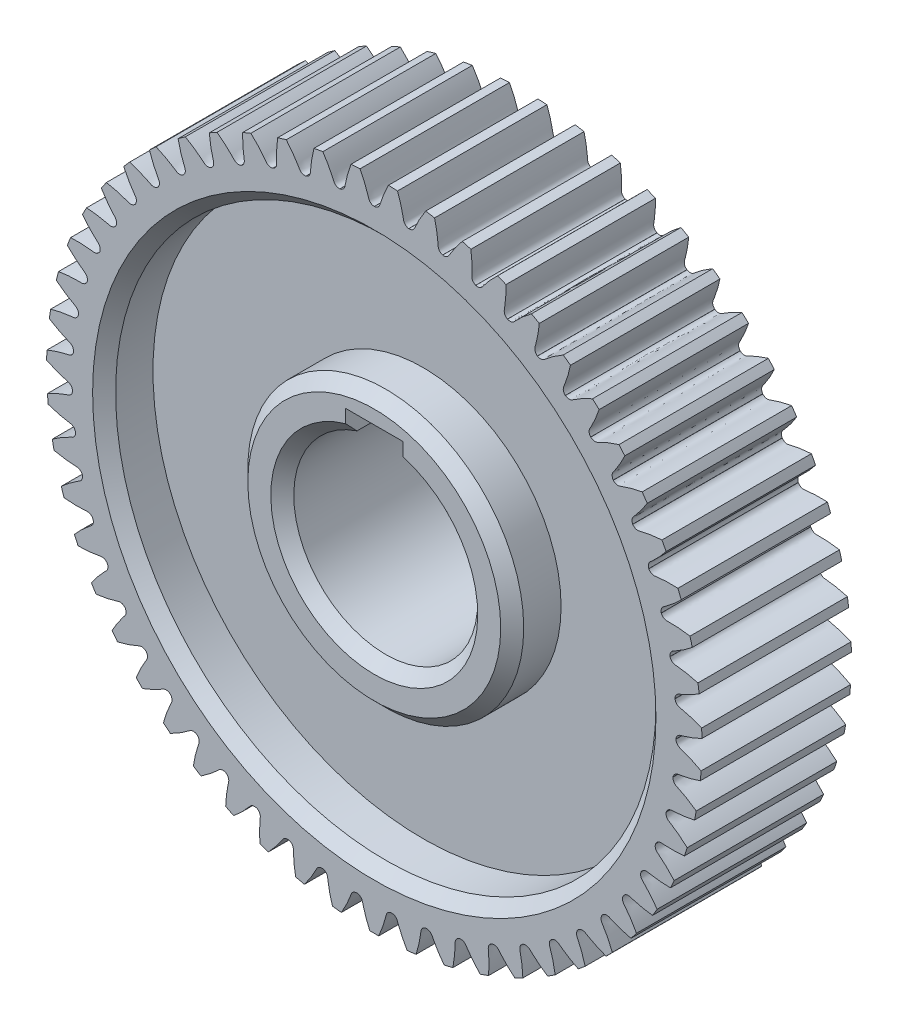
from build123d import *

# Parameters (mm, degrees)
SKETCH_1_R               = 57
EXTRUDE_1_DEPTH          = 26
CUT_EXTRUDE_1_DEPTH      = 85.699468711
PATTERN_CIRCULAR_1_COUNT = 55
CUT_EXTRUDE_2_DEPTH      = 85.695232382
CUT_EXTRUDE_2_DEPTH_BACK = 85.695232382
CHAMFER_1_SIZE           = 2
SKETCH_5_W               = 23
SKETCH_5_H               = 13.107025993
CHAMFER_2_SIZE           = 2
CHAMFER_3_SIZE           = 2


with BuildPart() as part:
    # 草图1 → 凸台-拉伸1 (new body)
    with BuildSketch(Plane.XY):
        Circle(SKETCH_1_R)
    extrude(amount=EXTRUDE_1_DEPTH)

    # 草图2 → 切除-拉伸1 (cut, through all)
    with BuildSketch(Plane.XY):
        with BuildLine():
            ThreePointArc((0.01, 52.499990226), (0, 52.499991179), (-0.01, 52.499990226))
            add(Edge.make_bspline(
                [(-0.01, 52.499990226), (-0.861117537, 52.612295874), (-0.981972241, 53.278161642), (-1.218473856, 54.010704315), (-1.322653063, 54.318142333), (-1.440444994, 54.642606879), (-1.572002283, 54.984022067), (-1.718213384, 55.34185575), (-1.879735962, 55.715680956), (-2.05727893, 56.105012024), (-2.251519582, 56.50935272), (-2.463126872, 56.928182723), (-2.692753963, 57.360961973), (-2.941039648, 57.807129888), (-3.208607239, 58.266106069), (-3.496064187, 58.737290603), (-3.804001509, 59.220064496), (-4.132993281, 59.71379008), (-4.48359613, 60.217811455), (-4.856348728, 60.731454931), (-5.251771318, 61.254029484), (-5.670365216, 61.784827231), (-6.112612407, 62.323123909), (-6.578974878, 62.868179376), (-7.242703238, 63.613215654), (-7.764444946, 64.164193823), (-8.1241098, 64.529512558)],
                knots=[0, 0, 0, 0, 0.114641067, 0.135337215, 0.15744152, 0.180953983, 0.205874602, 0.232203379, 0.259940313, 0.289085404, 0.319638652, 0.351600058, 0.38496962, 0.41974734, 0.455933217, 0.493527251, 0.532529443, 0.572939791, 0.614758297, 0.65798496, 0.70261978, 0.748662757, 0.796113891, 0.844973183, 0.895240631, 1, 1, 1, 1], degree=3))
            ThreePointArc((-8.1241098, 64.529512558), (0, 65.038904903), (8.1241098, 64.529512558))
            add(Edge.make_bspline(
                [(0.01, 52.499990226), (0.861117537, 52.612295874), (0.981972241, 53.278161642), (1.218473856, 54.010704315), (1.322653063, 54.318142333), (1.440444994, 54.642606879), (1.572002283, 54.984022067), (1.718213384, 55.34185575), (1.879735962, 55.715680956), (2.05727893, 56.105012024), (2.251519582, 56.50935272), (2.463126872, 56.928182723), (2.692753963, 57.360961973), (2.941039648, 57.807129888), (3.208607239, 58.266106069), (3.496064187, 58.737290603), (3.804001509, 59.220064496), (4.132993281, 59.71379008), (4.48359613, 60.217811455), (4.856348728, 60.731454931), (5.251771318, 61.254029484), (5.670365216, 61.784827231), (6.112612407, 62.323123909), (6.578974878, 62.868179376), (7.242703238, 63.613215654), (7.764444946, 64.164193823), (8.1241098, 64.529512558)],
                knots=[0, 0, 0, 0, 0.114641067, 0.135337215, 0.15744152, 0.180953983, 0.205874602, 0.232203379, 0.259940313, 0.289085404, 0.319638652, 0.351600058, 0.38496962, 0.41974734, 0.455933217, 0.493527251, 0.532529443, 0.572939791, 0.614758297, 0.65798496, 0.70261978, 0.748662757, 0.796113891, 0.844973183, 0.895240631, 1, 1, 1, 1], degree=3))
        make_face()
    cut_extrude_1 = extrude(amount=CUT_EXTRUDE_1_DEPTH, mode=Mode.SUBTRACT)

    # 阵列(圆周)1: 切除-拉伸1 ×55 about axis
    pattern_circular_1_axis = Axis((0, 0, 26), (0, 0, -1))
    for i in range(1, PATTERN_CIRCULAR_1_COUNT):
        add(cut_extrude_1.rotate(pattern_circular_1_axis, i * 360 / PATTERN_CIRCULAR_1_COUNT), mode=Mode.SUBTRACT)

    # 草图4 → 切除-拉伸2 (cut, two sides: drawn at the far end of the back side and taken through both)
    with BuildSketch(Plane.XY.offset(26).offset(-CUT_EXTRUDE_2_DEPTH_BACK)):
        with BuildLine():
            Line((-5, 19.6), (5, 19.6))
            Line((5, 19.6), (5, 15.198684154))
            ThreePointArc((5, 15.198684154), (0, -16), (-5, 15.198684154))
            Line((-5, 15.198684154), (-5, 19.6))
        make_face()
    extrude(amount=CUT_EXTRUDE_2_DEPTH + CUT_EXTRUDE_2_DEPTH_BACK, mode=Mode.SUBTRACT)

    # 倒角1
    chamfer_1_edges = [part.edges().sort_by_distance(p)[0] for p in [
        (0, -16, 26),
    ]]
    chamfer(chamfer_1_edges, length=CHAMFER_1_SIZE)

    # 草图5 → 切除-旋转1 (revolve, cut)
    with BuildSketch(Plane(origin=(0, 0, 0), x_dir=(1, 0, 0), z_dir=(0, 1, 0))):
        with Locations((-35.5, -1.946487003)):
            Rectangle(SKETCH_5_W, SKETCH_5_H)
        with Locations((-35.5, -24.053512997)):
            Rectangle(SKETCH_5_W, SKETCH_5_H)
    revolve(axis=Axis((0, 0, -32.09114424), (0, 0, -1)), mode=Mode.SUBTRACT)

    # 倒角2
    chamfer_2_edges = [part.edges().sort_by_distance(p)[0] for p in [
        (24, 0, 26),
        (47, 0, 26),
        (24, 0, 0),
        (47, 0, 0),
    ]]
    chamfer(chamfer_2_edges, length=CHAMFER_2_SIZE)

    # 倒角3
    chamfer_3_edges = [part.edges().sort_by_distance(p)[0] for p in [
        (0, -16, 0),
    ]]
    chamfer(chamfer_3_edges, length=CHAMFER_3_SIZE)


solid = part.part
